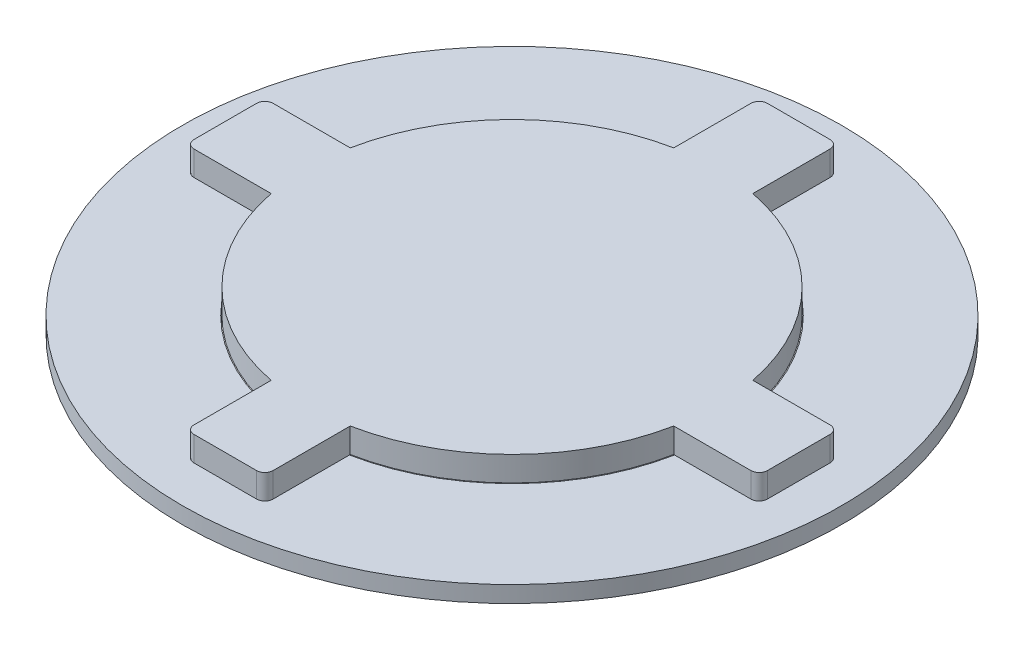
from build123d import *

# Parameters (mm, degrees)
CROQUIS5_R              = 24.9
SALIENTE_EXTRUIR3_DEPTH = 3
SALIENTE_EXTRUIR4_DEPTH = 3
CROQUIS7_R              = 40
SALIENTE_EXTRUIR5_DEPTH = 2
CORTAR_EXTRUIR3_DEPTH   = 2
CROQUIS9_R              = 2
CORTAR_EXTRUIR4_DEPTH   = 1


with BuildPart() as part:
    # Croquis5 → Saliente-Extruir3 (new body)
    with BuildSketch(Plane(origin=(0, 0, 0), x_dir=(1, 0, 0), z_dir=(0, 1, 0))):
        Circle(CROQUIS5_R)
    extrude(amount=SALIENTE_EXTRUIR3_DEPTH)

    # Croquis6 → Saliente-Extruir4 (add)
    with BuildSketch(Plane.XZ):
        with BuildLine():
            ThreePointArc((34.8, 3.8), (34.507106781, 4.507106781), (33.8, 4.8))
            Line((33.8, 4.8), (24.432969529, 4.8))
            ThreePointArc((24.432969529, 4.8), (24.9, 0), (24.432969529, -4.8))
            Line((24.432969529, -4.8), (33.8, -4.8))
            ThreePointArc((33.8, -4.8), (34.507106781, -4.507106781), (34.8, -3.8))
            Line((34.8, -3.8), (34.8, 3.8))
        make_face()
        with BuildLine():
            ThreePointArc((-4.8, 24.432969529), (0, 24.9), (4.8, 24.432969529))
            Line((4.8, 24.432969529), (4.8, 33.8))
            ThreePointArc((4.8, 33.8), (4.507106781, 34.507106781), (3.8, 34.8))
            Line((3.8, 34.8), (-3.8, 34.8))
            ThreePointArc((-3.8, 34.8), (-4.507106781, 34.507106781), (-4.8, 33.8))
            Line((-4.8, 33.8), (-4.8, 24.432969529))
        make_face()
        with BuildLine():
            ThreePointArc((-24.432969529, -4.8), (-24.9, 0), (-24.432969529, 4.8))
            Line((-24.432969529, 4.8), (-33.8, 4.8))
            ThreePointArc((-33.8, 4.8), (-34.507106781, 4.507106781), (-34.8, 3.8))
            Line((-34.8, 3.8), (-34.8, -3.8))
            ThreePointArc((-34.8, -3.8), (-34.507106781, -4.507106781), (-33.8, -4.8))
            Line((-33.8, -4.8), (-24.432969529, -4.8))
        make_face()
        with BuildLine():
            Line((4.8, -33.8), (4.8, -24.432969529))
            ThreePointArc((4.8, -24.432969529), (0, -24.9), (-4.8, -24.432969529))
            Line((-4.8, -24.432969529), (-4.8, -33.8))
            ThreePointArc((-4.8, -33.8), (-4.507106781, -34.507106781), (-3.8, -34.8))
            Line((-3.8, -34.8), (3.8, -34.8))
            ThreePointArc((3.8, -34.8), (4.507106781, -34.507106781), (4.8, -33.8))
        make_face()
    extrude(amount=-SALIENTE_EXTRUIR4_DEPTH)

    # Croquis7 → Saliente-Extruir5 (add)
    with BuildSketch(Plane.XZ):
        Circle(CROQUIS7_R)
    extrude(amount=SALIENTE_EXTRUIR5_DEPTH)

    # Croquis8 → Cortar-Extruir3 (cut)
    with BuildSketch(Plane.XZ.offset(2)):
        with BuildLine():
            Line((-2.5, -30), (2.5, -30))
            Line((2.5, -30), (2.5, -24.874685928))
            ThreePointArc((2.5, -24.874685928), (17.67766953, -17.67766953), (24.874685928, -2.5))
            Line((24.874685928, -2.5), (30, -2.5))
            Line((30, -2.5), (30, 2.5))
            Line((30, 2.5), (24.874685928, 2.5))
            ThreePointArc((24.874685928, 2.5), (17.67766953, 17.67766953), (2.5, 24.874685928))
            Line((2.5, 24.874685928), (2.5, 30))
            Line((2.5, 30), (-2.5, 30))
            Line((-2.5, 30), (-2.5, 24.874685928))
            ThreePointArc((-2.5, 24.874685928), (-17.67766953, 17.67766953), (-24.874685928, 2.5))
            Line((-24.874685928, 2.5), (-30, 2.5))
            Line((-30, 2.5), (-30, -2.5))
            Line((-30, -2.5), (-24.874685928, -2.5))
            ThreePointArc((-24.874685928, -2.5), (-17.67766953, -17.67766953), (-2.5, -24.874685928))
            Line((-2.5, -24.874685928), (-2.5, -30))
        make_face()
        with BuildLine():
            ThreePointArc((19.843134833, -2.5), (14.142135624, -14.142135624), (2.5, -19.843134833))
            Line((2.5, -19.843134833), (2.5, -2.5))
            Line((2.5, -2.5), (19.843134833, -2.5))
        make_face(mode=Mode.SUBTRACT)
        with BuildLine():
            ThreePointArc((-2.5, -19.843134833), (-14.142135624, -14.142135624), (-19.843134833, -2.5))
            Line((-19.843134833, -2.5), (-2.5, -2.5))
            Line((-2.5, -2.5), (-2.5, -19.843134833))
        make_face(mode=Mode.SUBTRACT)
        with BuildLine():
            Line((19.843134833, 2.5), (2.5, 2.5))
            Line((2.5, 2.5), (2.5, 19.843134833))
            ThreePointArc((2.5, 19.843134833), (14.142135624, 14.142135624), (19.843134833, 2.5))
        make_face(mode=Mode.SUBTRACT)
        with BuildLine():
            ThreePointArc((-19.843134833, 2.5), (-14.142135624, 14.142135624), (-2.5, 19.843134833))
            Line((-2.5, 19.843134833), (-2.5, 2.5))
            Line((-2.5, 2.5), (-19.843134833, 2.5))
        make_face(mode=Mode.SUBTRACT)
    extrude(amount=-CORTAR_EXTRUIR3_DEPTH, mode=Mode.SUBTRACT)

    # Croquis9 → Cortar-Extruir4 (cut)
    with BuildSketch(Plane.XZ):
        Circle(CROQUIS9_R)
    extrude(amount=-CORTAR_EXTRUIR4_DEPTH, mode=Mode.SUBTRACT)


solid = part.part
